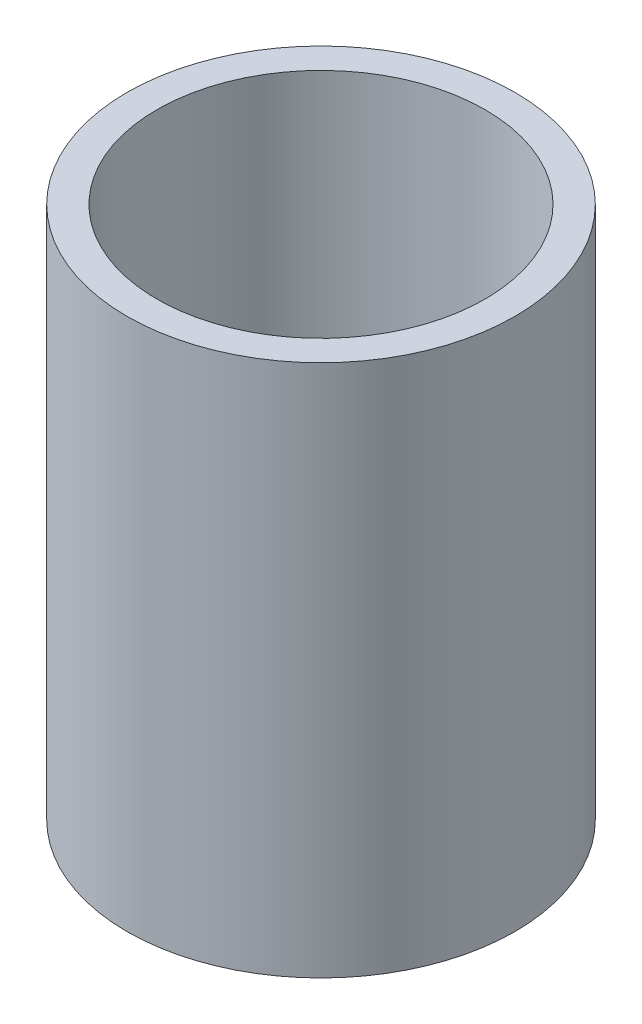
from build123d import *

# Parameters (mm, degrees)
SKETCH1_R           = 57.5
BOSS_EXTRUDE1_DEPTH = 157.949440908
SKETCH2_R           = 48.64312274
CUT_EXTRUDE1_DEPTH  = 178.652824022


with BuildPart() as part:
    # Sketch1 → Boss-Extrude1 (new body)
    with BuildSketch(Plane(origin=(0, 0, 0), x_dir=(1, 0, 0), z_dir=(0, 1, 0))):
        Circle(SKETCH1_R)
    extrude(amount=BOSS_EXTRUDE1_DEPTH)

    # Sketch2 → Cut-Extrude1 (cut, through all)
    with BuildSketch(Plane(origin=(0, 0, 0), x_dir=(1, 0, 0), z_dir=(0, 1, 0))):
        Circle(SKETCH2_R)
    extrude(amount=CUT_EXTRUDE1_DEPTH, mode=Mode.SUBTRACT)


solid = part.part
